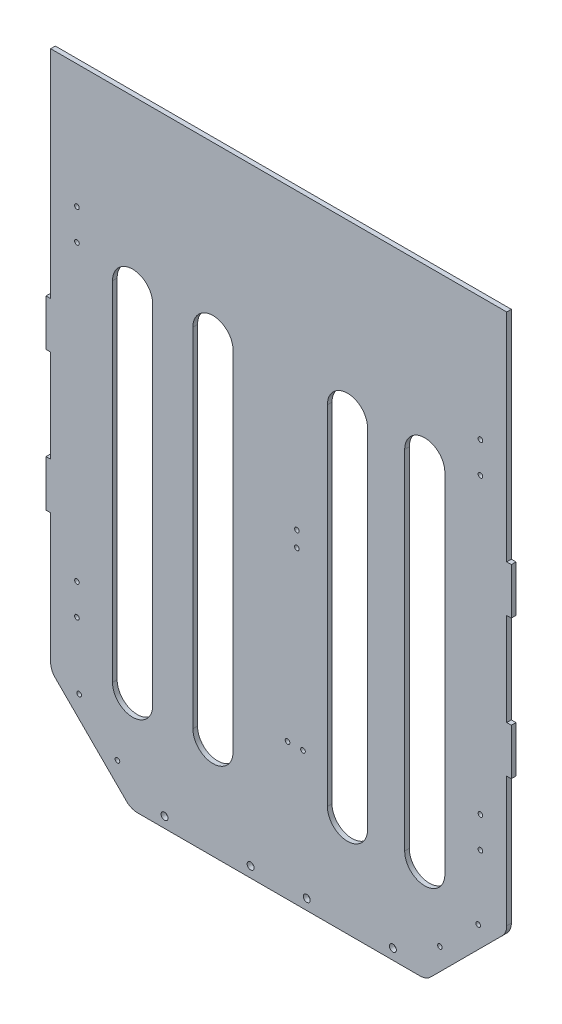
from build123d import *

# Parameters (mm, degrees)
EXTRUDE_1_DEPTH     = 3
CUT_EXTRUDE_2_DEPTH = 228.06662018
SKETCH_2_R          = 1.5
SKETCH_2_R_2        = 2.25
CUT_EXTRUDE_1_DEPTH = 10
SKETCH_4_R          = 1.5
CUT_EXTRUDE_3_DEPTH = 228.06662018
CUT_EXTRUDE_4_DEPTH = 228.06662018
FILLET_3_R          = 10
SKETCH_8_R          = 1.5
CUT_EXTRUDE_5_DEPTH = 228.06662018
SKETCH_9_W          = 295
SKETCH_9_H          = 60
EXTRUDE_2_DEPTH     = 3
SKETCH_10_R         = 1.5
CUT_EXTRUDE_6_DEPTH = 10


with BuildPart() as part:
    # 草图1 → 凸台-拉伸1 (new body)
    with BuildSketch(Plane.XY):
        Polygon((-147.5, 90), (-150.5, 90), (-150.5, 60), (-147.5, 60), (-147.5, 0), (-150.5, 0), (-150.5, -30), (-147.5, -30), (-147.5, -90), (-147.5, -120), (-147.5, -170), (147.5, -170), (147.5, -120), (147.5, -90), (147.5, -30), (150.5, -30), (150.5, 0), (147.5, 0), (147.5, 60), (150.5, 60), (150.5, 90), (147.5, 90), (147.5, 170), (-147.5, 170), align=None)
    extrude(amount=EXTRUDE_1_DEPTH)

    # 草图3 → 切除-拉伸2 (cut, through all)
    with BuildSketch(Plane.XY.offset(3)):
        Polygon((-147.5, -118), (-95.5, -170), (-147.5, -170), align=None)
        Polygon((147.5, -170), (147.5, -118), (95.5, -170), align=None)
    extrude(amount=-CUT_EXTRUDE_2_DEPTH, mode=Mode.SUBTRACT)

    # 草图2 → 切除-拉伸1 (cut)
    with BuildSketch(Plane.XY.offset(3)):
        with Locations((11.800454572, 40)):
            Circle(SKETCH_2_R)
        with Locations((11.800454572, 30)):
            Circle(SKETCH_2_R)
        with Locations((-73.85, -163.15)):
            Circle(SKETCH_2_R_2)
        with Locations((-18.15, -163.15)):
            Circle(SKETCH_2_R_2)
        with Locations((18.15, -163.15)):
            Circle(SKETCH_2_R_2)
        with Locations((73.85, -163.15)):
            Circle(SKETCH_2_R_2)
    extrude(amount=-CUT_EXTRUDE_1_DEPTH, mode=Mode.SUBTRACT)

    # 草图4 → 切除-拉伸3 (cut, through all)
    with BuildSketch(Plane.XY.offset(3)):
        with Locations((130.5, 150)):
            Circle(SKETCH_4_R)
        with Locations((130.5, 130)):
            Circle(SKETCH_4_R)
        with Locations((130.5, -60)):
            Circle(SKETCH_4_R)
        with Locations((130.5, -80)):
            Circle(SKETCH_4_R)
        with Locations((-130.5, -80)):
            Circle(SKETCH_4_R)
        with Locations((-130.5, -60)):
            Circle(SKETCH_4_R)
        with Locations((-130.5, 130)):
            Circle(SKETCH_4_R)
        with Locations((-130.5, 150)):
            Circle(SKETCH_4_R)
    extrude(amount=-CUT_EXTRUDE_3_DEPTH, mode=Mode.SUBTRACT)

    # 草图5 → 切除-拉伸4 (cut, through all)
    with BuildSketch(Plane.XY.offset(3)):
        with BuildLine():
            Line((-81.5, 120), (-81.5, -105))
            ThreePointArc((-81.5, -105), (-94.5, -118), (-107.5, -105))
            Line((-107.5, -105), (-107.5, 120))
            ThreePointArc((-107.5, 120), (-94.5, 133), (-81.5, 120))
        make_face()
        with BuildLine():
            Line((-29.5, 120), (-29.5, -105))
            ThreePointArc((-29.5, -105), (-42.5, -118), (-55.5, -105))
            Line((-55.5, -105), (-55.5, 120))
            ThreePointArc((-55.5, 120), (-42.5, 133), (-29.5, 120))
        make_face()
        with BuildLine():
            Line((57.5, 120), (57.5, -105))
            ThreePointArc((57.5, -105), (44.5, -118), (31.5, -105))
            Line((31.5, -105), (31.5, 120))
            ThreePointArc((31.5, 120), (44.5, 133), (57.5, 120))
        make_face()
        with BuildLine():
            Line((107.5, 120), (107.5, -105))
            ThreePointArc((107.5, -105), (94.5, -118), (81.5, -105))
            Line((81.5, -105), (81.5, 120))
            ThreePointArc((81.5, 120), (94.5, 133), (107.5, 120))
        make_face()
    extrude(amount=-CUT_EXTRUDE_4_DEPTH, mode=Mode.SUBTRACT)

    # 圆角3
    fillet_3_edges = [part.edges().sort_by_distance(p)[0] for p in [
        (147.5, -118, 1.5),
        (95.5, -170, 1.5),
        (-95.5, -170, 1.5),
        (-147.5, -118, 1.5),
    ]]
    fillet(fillet_3_edges, radius=FILLET_3_R)

    # 草图8 → 切除-拉伸5 (cut, through all)
    with BuildSketch(Plane.XY.offset(3)):
        with Locations((-129.044105664, -122.313758713)):
            Circle(SKETCH_8_R)
        with Locations((-104.295368322, -147.062496054)):
            Circle(SKETCH_8_R)
        with Locations((104.295368322, -147.062496054)):
            Circle(SKETCH_8_R)
        with Locations((129.044105664, -122.313758713)):
            Circle(SKETCH_8_R)
    extrude(amount=-CUT_EXTRUDE_5_DEPTH, mode=Mode.SUBTRACT)

    # 草图9 → 凸台-拉伸2 (add)
    with BuildSketch(Plane.XY.offset(3)):
        with Locations((0, 200)):
            Rectangle(SKETCH_9_W, SKETCH_9_H)
    extrude(amount=-EXTRUDE_2_DEPTH)

    # 草图10 → 切除-拉伸6 (cut)
    with BuildSketch(Plane(origin=(0, 0, 0), x_dir=(-1, 0, 0), z_dir=(0, 0, -1))):
        with Locations((-15.714480525, -81.497694715)):
            Circle(SKETCH_10_R)
        with Locations((-5.714480525, -81.497694715)):
            Circle(SKETCH_10_R)
    extrude(amount=-CUT_EXTRUDE_6_DEPTH, mode=Mode.SUBTRACT)


solid = part.part
